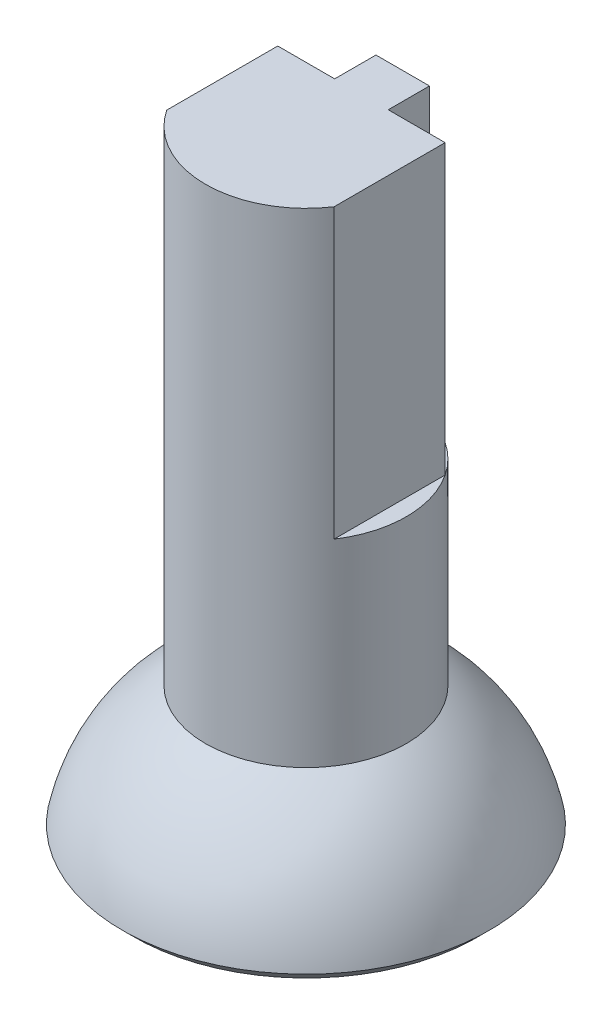
from build123d import *

# Parameters (mm, degrees)
CUT_EXTRUDE1_START = -5.461
CUT_EXTRUDE1_DEPTH = 5.461
CHAMFER1_SIZE      = 0.254


with BuildPart() as part:
    # Sketch3 → Revolve1 (revolve)
    with BuildSketch(Plane.XY):
        with BuildLine():
            Line((0, 12.192), (-1.905, 12.192))
            Line((-1.905, 12.192), (-1.905, 3.002683966))
            ThreePointArc((-1.905, 3.002683966), (-2.985336827, 1.932071435), (-3.519527241, 0.508))
            Line((-3.519527241, 0.508), (-2.639645431, 0.508))
            Line((-2.639645431, 0.508), (-2.199704526, 1.27))
            ThreePointArc((-2.199704526, 1.27), (-1.796051224, 1.796051224), (-1.27, 2.199704526))
            Line((-1.27, 2.199704526), (0, 2.932939367))
            Line((0, 2.932939367), (0, 12.192))
        make_face()
    revolve(axis=Axis((0, 12.192, 0), (0, -1, 0)))

    # Sketch4 → Cut-Extrude1 (cut)
    with BuildSketch(Plane(origin=(0, 12.192, 0), x_dir=(1, 0, 0), z_dir=(0, 1, 0)).offset(CUT_EXTRUDE1_START)):
        with BuildLine():
            Line((1.5875, 1.053028371), (1.5875, -1.053028371))
            ThreePointArc((1.5875, -1.053028371), (1.905, 0), (1.5875, 1.053028371))
        make_face()
        with BuildLine():
            Line((0.508, 1.053028371), (1.5875, 1.053028371))
            ThreePointArc((1.5875, 1.053028371), (1.118502631, 1.542069021), (0.508, 1.836017701))
            Line((0.508, 1.836017701), (0.508, 1.053028371))
        make_face()
        with BuildLine():
            ThreePointArc((-1.5875, 1.053028371), (-1.905, 0), (-1.5875, -1.053028371))
            Line((-1.5875, -1.053028371), (-1.5875, 1.053028371))
        make_face()
        with BuildLine():
            Line((-0.508, 1.836017701), (0.508, 1.836017701))
            ThreePointArc((0.508, 1.836017701), (0, 1.905), (-0.508, 1.836017701))
        make_face()
        with BuildLine():
            ThreePointArc((-0.508, 1.836017701), (-1.118502631, 1.542069021), (-1.5875, 1.053028371))
            Line((-1.5875, 1.053028371), (-0.508, 1.053028371))
            Line((-0.508, 1.053028371), (-0.508, 1.836017701))
        make_face()
    extrude(amount=CUT_EXTRUDE1_DEPTH, mode=Mode.SUBTRACT)

    # Chamfer1
    # the kernel refuses this chamfer: 0.254, 0.224262667 mm, written as the material it takes off along each edge
    with BuildSketch(Plane(origin=(0, 0.508, 0), x_dir=(-1, 0, 0), z_dir=(0, 0, 1))) as chamfer1_piece_1:
        with BuildLine():
            Line((3.519527241 - CHAMFER1_SIZE, 0), (3.481518689, -0.215991448))
            ThreePointArc((3.481518689, -0.215991448), (3.501682417, -0.111157692), (3.519527241, 0))
            Line((3.519527241, 0), (3.519527241 - CHAMFER1_SIZE, 0))
        make_face()
    revolve(axis=Axis((0, 0.508, 0), (0, -1, 0)), mode=Mode.SUBTRACT)


solid = part.part
